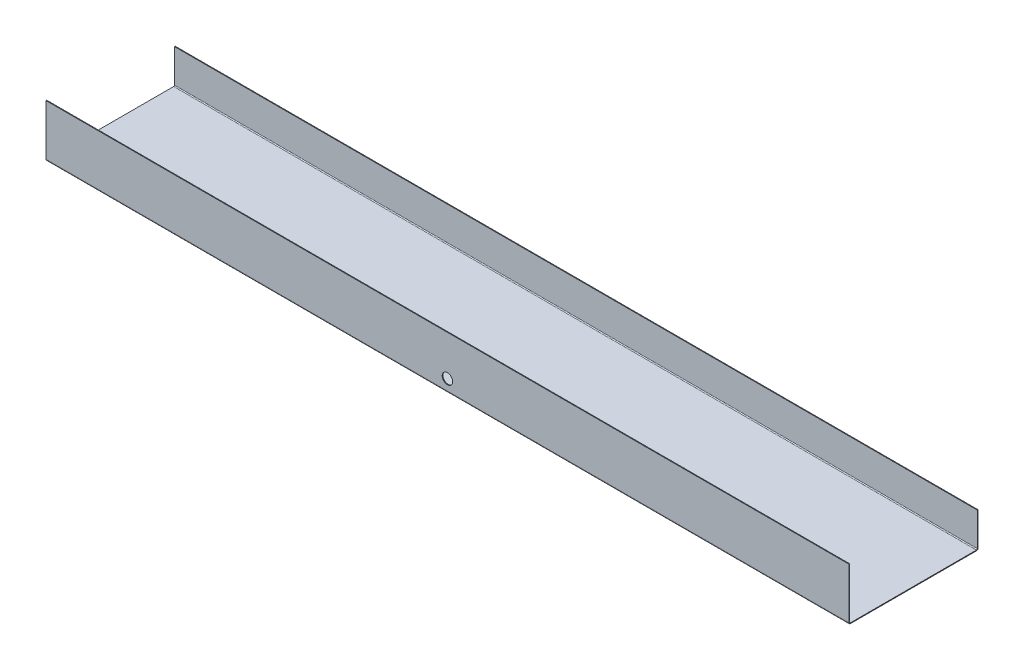
from build123d import *

# Parameters (mm, degrees)
BASE_FLANGE1_DEPTH = 1150
SKETCH2_R          = 15
CUT_EXTRUDE1_DEPTH = 10


# Sheet-metal steps are written as plain solids
with BuildPart() as part:
    # Sketch1 → Base-Flange1 (new, symmetric)
    with BuildSketch(Plane(origin=(0, 0, 0), x_dir=(0, 0, -1), z_dir=(1, 0, 0))):
        with BuildLine():
            Line((0, 0), (0, -145.5))
            ThreePointArc((0, -145.5), (1.318019485, -148.681980515), (4.5, -150))
            Line((4.5, -150), (365.5, -150))
            ThreePointArc((365.5, -150), (368.681980515, -148.681980515), (370, -145.5))
            Line((370, -145.5), (370, -50))
            Line((370, -50), (368, -50))
            Line((368, -50), (368, -145.5))
            ThreePointArc((368, -145.5), (367.267766953, -147.267766953), (365.5, -148))
            Line((365.5, -148), (4.5, -148))
            ThreePointArc((4.5, -148), (2.732233047, -147.267766953), (2, -145.5))
            Line((2, -145.5), (2, 0))
            Line((2, 0), (0, 0))
        make_face()
    extrude(amount=BASE_FLANGE1_DEPTH, both=True)

    # Sketch2 → Cut-Extrude1 (cut)
    with BuildSketch(Plane.XY):
        with Locations((0, -115)):
            Circle(SKETCH2_R)
    extrude(amount=-CUT_EXTRUDE1_DEPTH, mode=Mode.SUBTRACT)


solid = part.part
